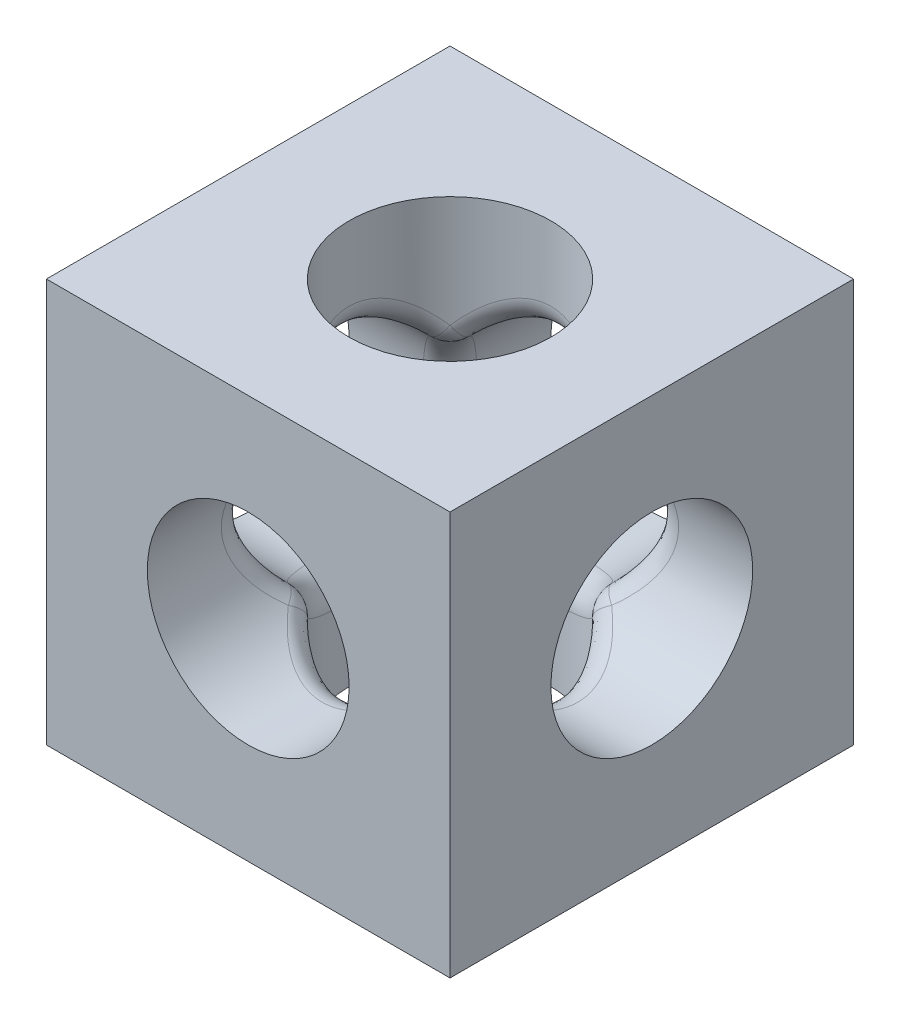
from build123d import *

# Parameters (mm, degrees)
SKETCH_1_W          = 6
SKETCH_1_H          = 6
SKETCH_1_R          = 1.5
EXTRUDE_1_DEPTH     = 6
SKETCH_2_R          = 1.5
CUT_EXTRUDE_1_DEPTH = 6
SKETCH_3_R          = 1.5
CUT_EXTRUDE_2_DEPTH = 6
FILLET_1_R          = 0.4


with BuildPart() as part:
    # 草图1 → 凸台-拉伸1 (new body)
    with BuildSketch(Plane(origin=(0, 0, 0), x_dir=(1, 0, 0), z_dir=(0, 1, 0))):
        with Locations((3, 3)):
            Rectangle(SKETCH_1_W, SKETCH_1_H)
        with Locations((3, 3)):
            Circle(SKETCH_1_R, mode=Mode.SUBTRACT)
    extrude(amount=EXTRUDE_1_DEPTH)

    # 草图2 → 切除-拉伸1 (cut)
    with BuildSketch(Plane.XY):
        with Locations((3, 3)):
            Circle(SKETCH_2_R)
    extrude(amount=-CUT_EXTRUDE_1_DEPTH, mode=Mode.SUBTRACT)

    # 草图3 → 切除-拉伸2 (cut)
    with BuildSketch(Plane(origin=(6, 0, 0), x_dir=(0, 0, -1), z_dir=(1, 0, 0))):
        with Locations((3, 3)):
            Circle(SKETCH_3_R)
    extrude(amount=-CUT_EXTRUDE_2_DEPTH, mode=Mode.SUBTRACT)

    # 圆角1
    fillet_1_edges = [part.edges().sort_by_distance(p)[0] for p in [
        (2.395519074, 1.627191634, -4.372808366),
        (3, 4.5, -4.5),
        (3.604480926, 1.627191634, -1.627191634),
        (3, 4.5, -1.5),
        (1.5, 4.5, -3),
        (1.627191634, 1.627191634, -2.395519074),
        (4.372808366, 1.627191634, -2.395519074),
        (4.372808366, 4.372808366, -3.604480926),
        (4.372808366, 3.604480926, -4.372808366),
        (1.627191634, 3.604480926, -4.372808366),
        (1.627191634, 2.395519074, -1.627191634),
        (4.372808366, 2.395519074, -1.627191634),
    ]]
    fillet(fillet_1_edges, radius=FILLET_1_R)


solid = part.part
